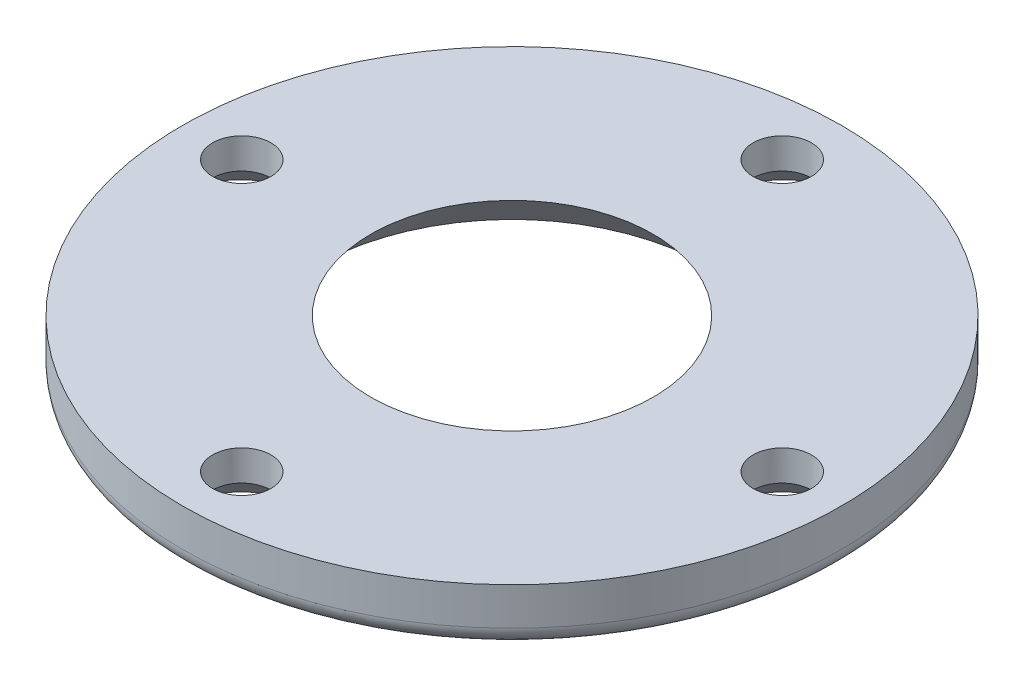
from build123d import *

# Parameters (mm, degrees)
SKETCH1_R                    = 17.5
SKETCH1_R_2                  = 7.5
BOSS_EXTRUDE1_DEPTH          = 3
SKETCH3_R                    = 1.55
CUT_EXTRUDE1_DEPTH           = 5
CHAMFER6_SIZE                = 1.38
CIRPATTERN2_COUNT            = 4
CHAMFER6_OF_CIRPATTERN2_SIZE = 1.38
CHAMFER7_SIZE                = 3
FILLET1_R                    = 1


# Some blends are built 0.0001 mm under size
with BuildPart() as part:
    # Sketch1 → Boss-Extrude1 (new body)
    with BuildSketch(Plane(origin=(0, 0, 0), x_dir=(1, 0, 0), z_dir=(0, 1, 0))):
        with Locations(Location((0, 0, 0), (0, 0, 270))):
            Circle(SKETCH1_R)
        with Locations(Location((0, 0, 0), (0, 0, 270))):
            Circle(SKETCH1_R_2, mode=Mode.SUBTRACT)
    extrude(amount=BOSS_EXTRUDE1_DEPTH)

    # Sketch3 → Cut-Extrude1 (cut)
    with BuildSketch(Plane.XZ):
        with Locations(Location((0, 14.35, 0), (0, 0, 270))):
            Circle(SKETCH3_R)
    cut_extrude1 = extrude(amount=-CUT_EXTRUDE1_DEPTH, mode=Mode.SUBTRACT)

    # Chamfer6
    chamfer6_edges = [part.edges().sort_by_distance(p)[0] for p in [
        (0, 0, 15.9),
    ]]
    chamfer(chamfer6_edges, length=CHAMFER6_SIZE)

    # CirPattern2: Cut-Extrude1 ×4 about axis
    cirpattern2_axis = Axis((0, 0, 0), (0, 1, 0))
    for i in range(1, CIRPATTERN2_COUNT):
        add(cut_extrude1.rotate(cirpattern2_axis, i * 360 / CIRPATTERN2_COUNT), mode=Mode.SUBTRACT)

    # Chamfer6 of CirPattern2
    chamfer6_of_cirpattern2_edges = [part.edges().sort_by_distance(p)[0] for p in [
        (15.9, 0, 0),
        (0, 0, -15.9),
        (-15.9, 0, 0),
    ]]
    chamfer(chamfer6_of_cirpattern2_edges, length=CHAMFER6_OF_CIRPATTERN2_SIZE)

    # Chamfer7
    chamfer7_edges = [part.edges().sort_by_distance(p)[0] for p in [
        (0, 0, -7.5),
    ]]
    chamfer(chamfer7_edges, length=CHAMFER7_SIZE - 0.0001)  # a hair under: the kernel refuses the full size

    # Fillet1
    # the kernel refuses this fillet: 1 mm, written as the material it takes off along each edge
    with BuildSketch(Plane(origin=(0, 0, 0), x_dir=(0, 0, 1), z_dir=(-1, 0, 0))) as fillet1_piece_1:
        with BuildLine():
            CenterArc((17.5 - FILLET1_R, FILLET1_R), FILLET1_R, 270, 90)
            Line((17.5, FILLET1_R), (17.5, 0))
            Line((17.5, 0), (17.5 - FILLET1_R, 0))
        make_face()
    revolve(axis=Axis((0, 0, 0), (0, 1, 0)), mode=Mode.SUBTRACT)


solid = part.part
